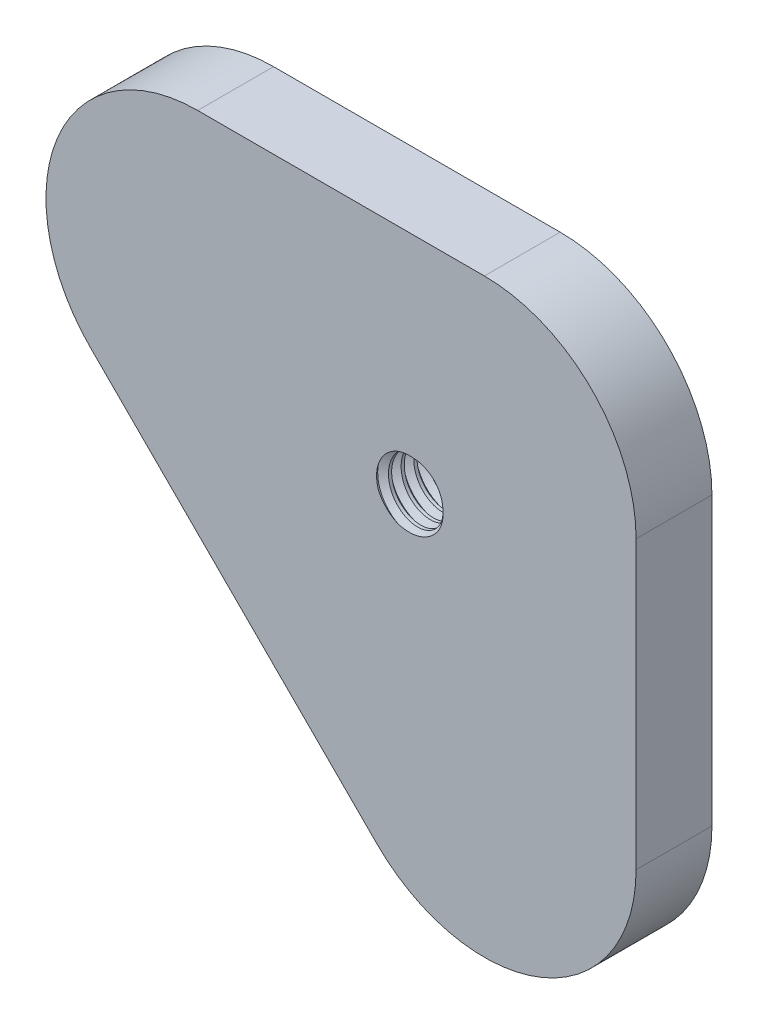
from build123d import *

# Parameters (mm, degrees)
SKETCH1_R           = 2.4
BOSS_EXTRUDE1_DEPTH = 6
THREAD1_PITCH       = 1


with BuildPart() as part:
    # Sketch1 → Boss-Extrude1 (new body)
    with BuildSketch(Plane.XY):
        with BuildLine():
            Line((584.514718626, 561.845671067), (561.845671067, 584.514718626))
            ThreePointArc((561.845671067, 584.514718626), (559.244398052, 597.592201188), (570.330952442, 605))
            Line((570.330952442, 605), (593, 605))
            ThreePointArc((593, 605), (601.485281374, 601.485281374), (605, 593))
            Line((605, 593), (605, 570.330952442))
            ThreePointArc((605, 570.330952442), (597.592201188, 559.244398052), (584.514718626, 561.845671067))
        make_face()
        with Locations((587.32233047, 587.32233047)):
            Circle(SKETCH1_R, mode=Mode.SUBTRACT)
    extrude(amount=BOSS_EXTRUDE1_DEPTH)

    # Thread1: the profile of Thread Profile1 profile screwed along a right-hand helix of 10 turns, 8 arcs to a turn; built about Z, then put on its axis
    thread1_z = Axis((0, 0, 0), (0, 0, 1))
    thread1_corners = [(2.3997, 0, -0.000173205), (2.941265875, 0, 0.312499999), (2.941265875, 0, 0.437499999), (2.3997, 0, 0.750173202)]
    with BuildLine(mode=Mode.PRIVATE) as thread1_profile:
        Line(thread1_corners[0], thread1_corners[1])
        Line(thread1_corners[1], thread1_corners[2])
        Line(thread1_corners[2], thread1_corners[3])
        Line(thread1_corners[3], thread1_corners[0])
    thread1_cap = Face(thread1_profile.wire())
    thread1_turn_angles = [0, 22.5, 45, 67.5, 90, 112.5, 135, 157.5, 180, 202.5, 225, 247.5, 270, 292.5, 315, 337.5, 360]
    thread1_turn_weights = [1, 0.9238795325112867, 1, 0.9238795325112867, 1, 0.9238795325112867, 1, 0.9238795325112867, 1, 0.9238795325112867, 1, 0.9238795325112867, 1, 0.9238795325112867, 1, 0.9238795325112867, 1]
    thread1_turn_rails = [Edge.make_bspline([Vector(p[0], p[1], 0).rotate(thread1_z, thread1_turn_angles[k]) / thread1_turn_weights[k] + Vector(0, 0, p[2] + THREAD1_PITCH * thread1_turn_angles[k] / 360) for k in range(17)], [0, 0, 0, 1, 1, 2, 2, 3, 3, 4, 4, 5, 5, 6, 6, 7, 7, 8, 8, 8], 2, thread1_turn_weights) for p in thread1_corners]
    thread1_turn_sides = [Face.make_surface_from_curves(thread1_turn_rails[p[0]], thread1_turn_rails[p[1]]) for p in [(0, 1), (1, 2), (2, 3), (3, 0)]]
    thread1 = Plane(origin=(587.32233047, 587.32233047, 0), x_dir=(1, 0, 0), z_dir=(0, 0, 1)) * Solid(Shell([*[p.moved(Location((0, 0, THREAD1_PITCH * i))) for i in range(10) for p in thread1_turn_sides], thread1_cap, thread1_cap.rotate(thread1_z, 3600).moved(Location((0, 0, THREAD1_PITCH * 3600 / 360)))]))
    add(thread1, mode=Mode.SUBTRACT)


solid = part.part
